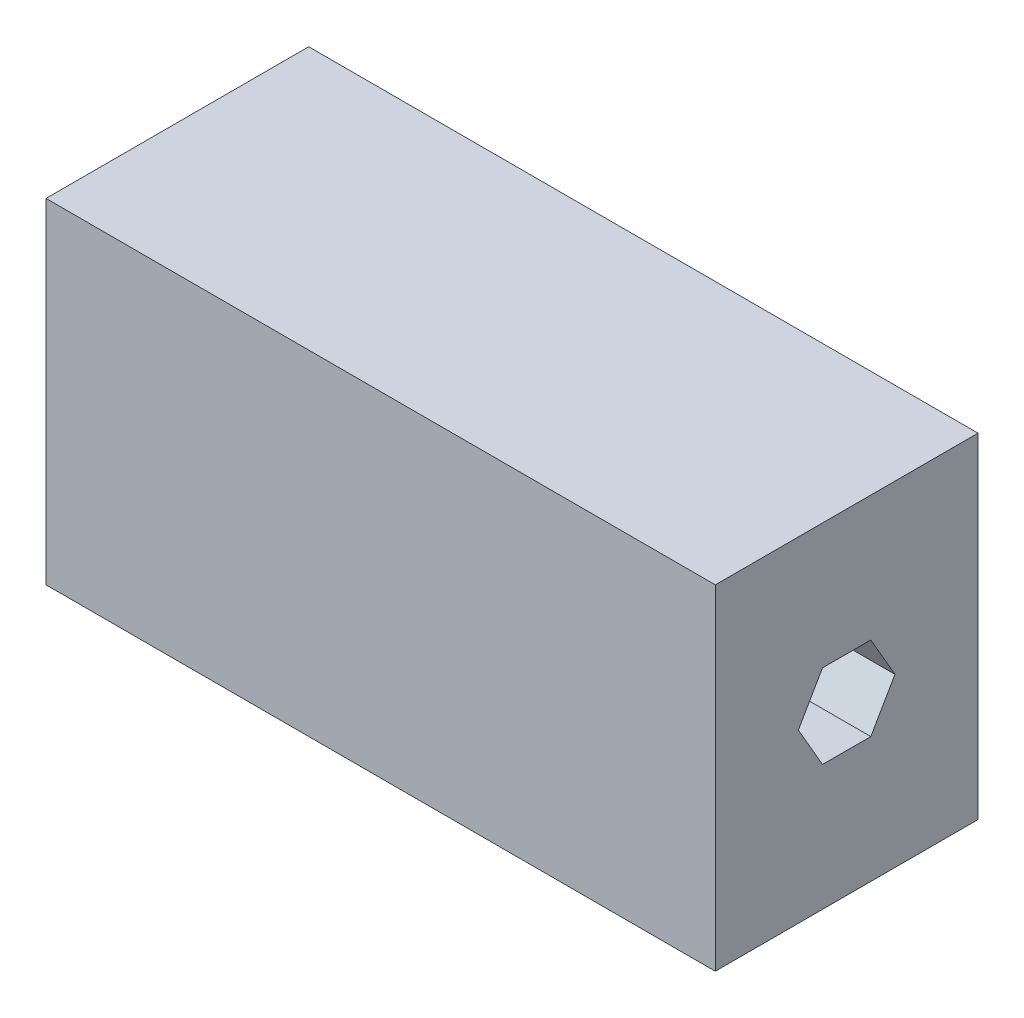
from build123d import *

# Parameters (mm, degrees)
SKETCH1_W           = 39.878
SKETCH1_H           = 50.8
BOSS_EXTRUDE1_DEPTH = 101.6
CUT_EXTRUDE2_DEPTH  = 107.608084689


with BuildPart() as part:
    # Sketch1 → Boss-Extrude1 (new body)
    with BuildSketch(Plane(origin=(0, 0, 0), x_dir=(0, 0, -1), z_dir=(1, 0, 0))):
        Rectangle(SKETCH1_W, SKETCH1_H)
    extrude(amount=BOSS_EXTRUDE1_DEPTH)

    # Sketch3 → Cut-Extrude2 (cut, through all)
    with BuildSketch(Plane(origin=(101.6, 0, 0), x_dir=(0, 0, -1), z_dir=(1, 0, 0))):
        Polygon((7.332348419, 0), (3.666174209, 6.35), (-3.666174209, 6.35), (-7.332348419, 0), (-3.666174209, -6.35), (3.666174209, -6.35), align=None)
    extrude(amount=-CUT_EXTRUDE2_DEPTH, mode=Mode.SUBTRACT)


solid = part.part
